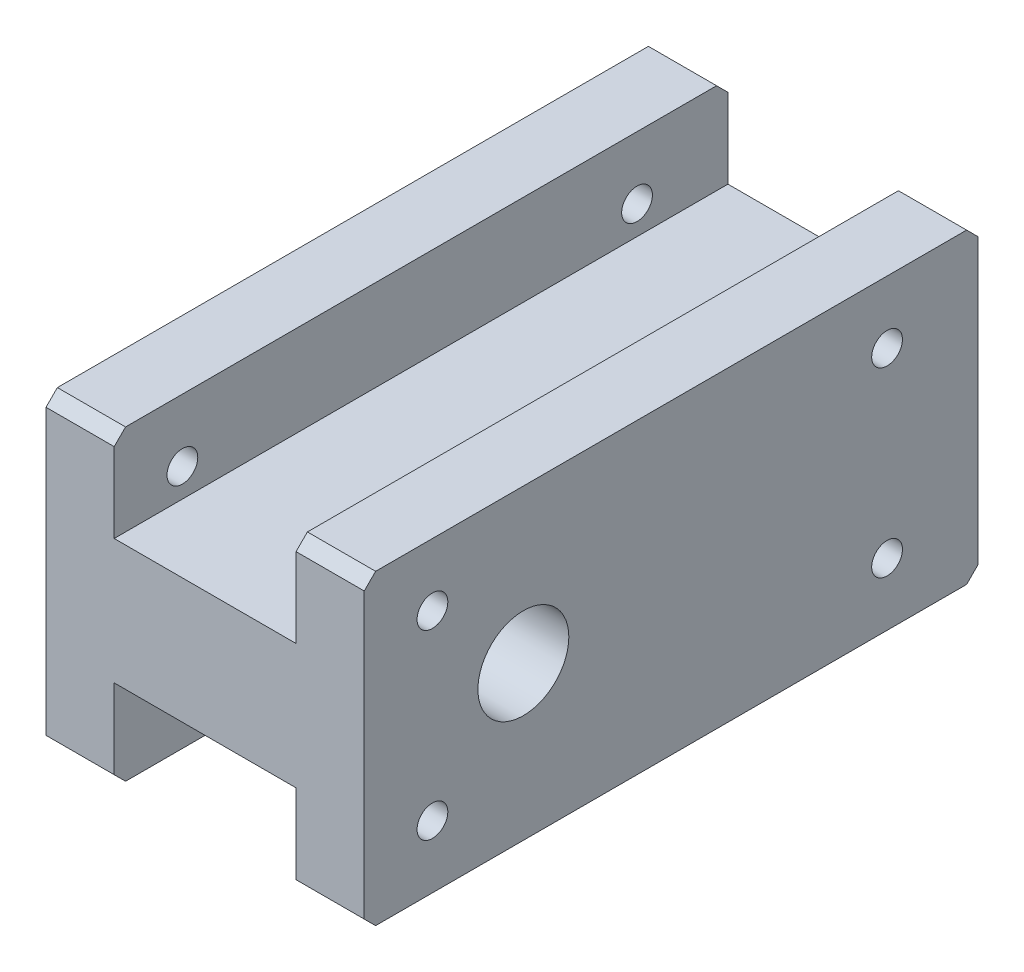
from build123d import *

# Parameters (mm, degrees)
SKETCH1_W             = 54
SKETCH1_H             = 27
SKETCH1_R             = 4
BOSS_EXTRUDE1_DEPTH   = 28
F_6_32_TAPPED_HOLE1_D = 2.7051
SKETCH4_W             = 16
SKETCH4_H             = 8
CUT_EXTRUDE1_DEPTH    = 63.307704179
CHAMFER1_SIZE         = 1


with BuildPart() as part:
    # Sketch1 → Boss-Extrude1 (new body)
    with BuildSketch(Plane(origin=(0, 0, 0), x_dir=(0, 0, -1), z_dir=(1, 0, 0))):
        with Locations((13, 0)):
            Rectangle(SKETCH1_W, SKETCH1_H)
        Circle(SKETCH1_R, mode=Mode.SUBTRACT)
    extrude(amount=-BOSS_EXTRUDE1_DEPTH)

    # #6-32 Tapped Hole1 (through all)
    with Locations(Plane(origin=(0, 0, 0), x_dir=(0, 0, -1), z_dir=(1, 0, 0))):
        with Locations((-8, 8), (-8, -8), (32, -8), (32, 8)):
            Hole(F_6_32_TAPPED_HOLE1_D / 2)

    # Sketch4 → Cut-Extrude1 (cut, through all)
    with BuildSketch(Plane.XY.offset(14)):
        with Locations((-14, 9.5)):
            Rectangle(SKETCH4_W, SKETCH4_H)
        with Locations((-14, -9.5)):
            Rectangle(SKETCH4_W, SKETCH4_H)
    extrude(amount=-CUT_EXTRUDE1_DEPTH, mode=Mode.SUBTRACT)

    # Chamfer1
    chamfer1_edges = [part.edges().sort_by_distance(p)[0] for p in [
        (-25, -13.5, -40),
        (-3, -13.5, -40),
        (-3, -13.5, 14),
        (-25, -13.5, 14),
        (-3, 13.5, -40),
        (-25, 13.5, -40),
        (-3, 13.5, 14),
        (-25, 13.5, 14),
    ]]
    chamfer(chamfer1_edges, length=CHAMFER1_SIZE)


solid = part.part
